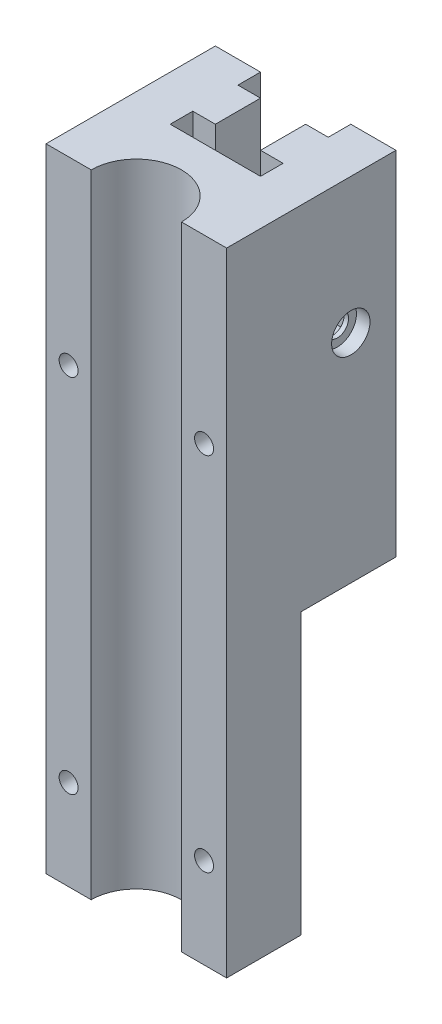
from build123d import *

# Parameters (mm, degrees)
BOSS_EXTRUDE1_DEPTH     = 140
SKETCH5_W               = 40
SKETCH5_H               = 21
CUT_EXTRUDE5_DEPTH      = 62
CUT_EXTRUDE2_DEPTH      = 1
CUT_EXTRUDE2_DEPTH_BACK = 30
CUT_EXTRUDE2_START      = -5
SKETCH3_W               = 10
SKETCH3_H               = 10
SKETCH3_3_R             = 2.5
CUT_EXTRUDE3_DEPTH      = 151.353749538
SKETCH3_5_R             = 4.25
SKETCH3_5_R_2           = 2.5
CUT_EXTRUDE4_DEPTH      = 3
SKETCH7_R               = 2.1
CUT_EXTRUDE7_DEPTH      = 10


with BuildPart() as part:
    # Sketch1 → Boss-Extrude1 (new body)
    with BuildSketch(Plane(origin=(0, 0, 0), x_dir=(1, 0, 0), z_dir=(0, 1, 0))):
        with BuildLine():
            Line((-10, -5), (-10, 0))
            Line((-10, 0), (-20, 0))
            Line((-20, 0), (-20, -37.5))
            Line((-20, -37.5), (-10, -37.5))
            ThreePointArc((-10, -37.5), (0, -27.5), (10, -37.5))
            Line((10, -37.5), (20, -37.5))
            Line((20, -37.5), (20, 0))
            Line((20, 0), (10, 0))
            Line((10, 0), (10, -5))
            Line((10, -5), (5, -5))
            Line((5, -5), (5, -15))
            Line((5, -15), (10, -15))
            Line((10, -15), (10, -20))
            Line((10, -20), (-10, -20))
            Line((-10, -20), (-10, -15))
            Line((-10, -15), (-5, -15))
            Line((-5, -15), (-5, -5))
            Line((-5, -5), (-10, -5))
        make_face()
    extrude(amount=-BOSS_EXTRUDE1_DEPTH)

    # Sketch5 → Cut-Extrude5 (cut)
    with BuildSketch(Plane.XZ.offset(140)):
        with Locations((0, 10.5)):
            Rectangle(SKETCH5_W, SKETCH5_H)
    extrude(amount=-CUT_EXTRUDE5_DEPTH, mode=Mode.SUBTRACT)

    # Sketch3 → Cut-Extrude2 (cut, two sides: drawn at the far end of the back side and taken through both)
    with BuildSketch(Plane(origin=(20, 0, 0), x_dir=(0, 0, -1), z_dir=(1, 0, 0)).offset(CUT_EXTRUDE2_START - CUT_EXTRUDE2_DEPTH_BACK)):
        with Locations((-10, -30)):
            Rectangle(SKETCH3_W, SKETCH3_H)
    extrude(amount=CUT_EXTRUDE2_DEPTH + CUT_EXTRUDE2_DEPTH_BACK, mode=Mode.SUBTRACT)

    # Sketch3<3> → Cut-Extrude3 (cut, through all)
    with BuildSketch(Plane(origin=(20, 0, 0), x_dir=(0, 0, -1), z_dir=(1, 0, 0))):
        with Locations((-10, -30)):
            Circle(SKETCH3_3_R)
    extrude(amount=-CUT_EXTRUDE3_DEPTH, mode=Mode.SUBTRACT)

    # Sketch3<5> → Cut-Extrude4 (cut)
    with BuildSketch(Plane(origin=(20, 0, 0), x_dir=(0, 0, -1), z_dir=(1, 0, 0))):
        with Locations((-10, -30)):
            Circle(SKETCH3_5_R)
        with Locations((-10, -30)):
            Circle(SKETCH3_5_R_2, mode=Mode.SUBTRACT)
    cut_extrude4 = extrude(amount=-CUT_EXTRUDE4_DEPTH, mode=Mode.SUBTRACT)

    # Mirror1: Cut-Extrude4 across plane
    add(cut_extrude4.mirror(Plane(origin=(0, 0, 0), x_dir=(0, 0, 1), z_dir=(1, 0, 0))), mode=Mode.SUBTRACT)

    # Sketch7 → Cut-Extrude7 (cut)
    with BuildSketch(Plane.XY.offset(37.5)):
        with Locations((-15, -120)):
            Circle(SKETCH7_R)
        with Locations((15, -120)):
            Circle(SKETCH7_R)
        with Locations((-15, -40)):
            Circle(SKETCH7_R)
        with Locations((15, -40)):
            Circle(SKETCH7_R)
    extrude(amount=-CUT_EXTRUDE7_DEPTH, mode=Mode.SUBTRACT)


solid = part.part
